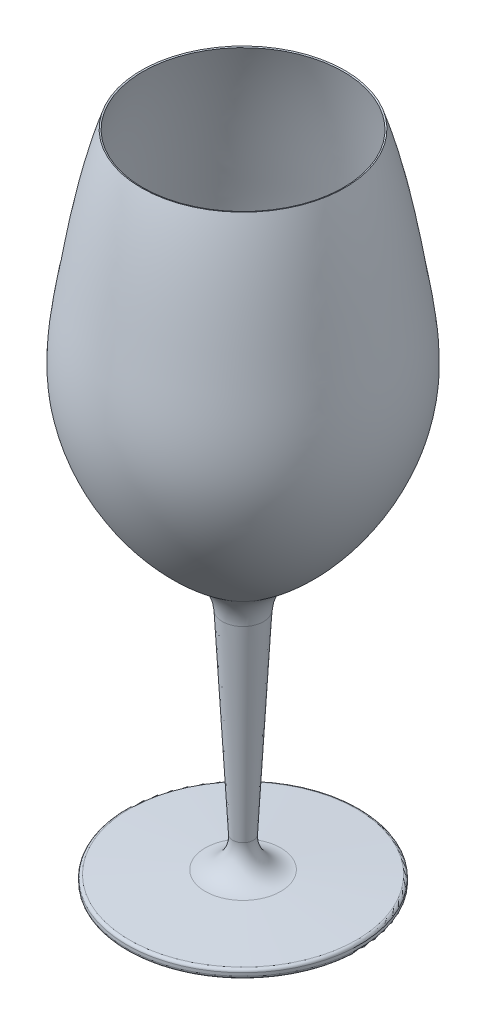
from build123d import *

# Parameters (mm, degrees)
REVOLVE_THIN1_OUTLINE_W   = 7.365807556
REVOLVE_THIN1_OUTLINE_H   = 0.5
REVOLVE_THIN1_OUTLINE_W_2 = 0.134192444
FILLET1_R                 = 10
FILLET2_R                 = 16
FILLET3_R                 = 1


# Read off the part's stored shape, not the designer's step: Revolve-Thin1
with BuildPart() as part:
    # Revolve-Thin1 outline → Revolve-Thin1 (revolve)
    with BuildSketch(Plane.XY):
        with Locations((3.682903778, 90.25)):
            Rectangle(REVOLVE_THIN1_OUTLINE_W, REVOLVE_THIN1_OUTLINE_H)
        with BuildLine():
            add(Edge.make_bspline(
                [(7.5, 90.577978433), (7.455285949, 90.551931479), (7.410555095, 90.525938631), (7.365807556, 90.5)],
                knots=[0.99893007, 0.99893007, 0.99893007, 0.99893007, 1, 1, 1, 1], degree=3))
            Line((7.365807556, 90.5), (7.5, 90.5))
            Line((7.5, 90.5), (7.5, 90.577978433))
        make_face()
        with Locations((7.432903778, 90.25)):
            Rectangle(REVOLVE_THIN1_OUTLINE_W_2, REVOLVE_THIN1_OUTLINE_H)
        with BuildLine():
            add(Edge.make_bspline(
                [(34.526035746, 116.224068176), (34.512660612, 116.204150697), (34.499276892, 116.184238728), (27.396765127, 105.626990517), (17.903178429, 96.638067113), (7.5, 90.577978433)],
                knots=[0.749529738, 0.749529738, 0.749529738, 0.749529738, 0.75, 0.75, 0.99893007, 0.99893007, 0.99893007, 0.99893007], degree=3))
            Line((7.5, 90.577978433), (7.5, 90.5))
            Line((7.5, 90.5), (8.352912818, 90.5))
            add(Edge.make_bspline(
                [(34.526035746, 115.332949182), (27.575400822, 105.173919249), (18.409466047, 96.486433496), (8.352912818, 90.5)],
                knots=[0.753639532, 0.753639532, 0.753639532, 0.753639532, 0.993242921, 0.993242921, 0.993242921, 0.993242921], degree=3))
            Line((34.526035746, 115.332949182), (34.526035746, 116.224068176))
        make_face()
        with BuildLine():
            Line((8.352912818, 90.5), (7.5, 90.5))
            Line((7.5, 90.5), (7.5, 90))
            add(Edge.make_bspline(
                [(8.352912818, 90.5), (8.069306953, 90.331175989), (7.784992776, 90.16450013), (7.5, 90)],
                knots=[0.993242921, 0.993242921, 0.993242921, 0.993242921, 1, 1, 1, 1], degree=3))
        make_face()
        with BuildLine():
            add(Edge.make_bspline(
                [(35, 116.937654659), (34.843239639, 116.699022317), (34.685245979, 116.461154885), (34.526035746, 116.224068176)],
                knots=[0.743931995, 0.743931995, 0.743931995, 0.743931995, 0.749529738, 0.749529738, 0.749529738, 0.749529738], degree=3))
            Line((34.526035746, 116.224068176), (34.526035746, 115.332949182))
            add(Edge.make_bspline(
                [(35, 116.033110225), (34.843184029, 115.798961501), (34.685190644, 115.565569566), (34.526035746, 115.332949182)],
                knots=[0.748153119, 0.748153119, 0.748153119, 0.748153119, 0.753639532, 0.753639532, 0.753639532, 0.753639532], degree=3))
            Line((35, 116.033110225), (35, 116.937654659))
        make_face()
        with BuildLine():
            add(Edge.make_bspline(
                [(35, 223.406176232), (38.707754789, 211.992882418), (41.019034398, 200.307274966), (43.602577081, 185.350494264), (44.119501526, 182.246673107), (45.155101131, 176.021305771), (45.666413266, 172.90348054), (46.954080187, 163.557105891), (47.483447687, 157.336251858), (46.887857201, 148.10906378), (46.448454036, 145.046089868), (45.124841561, 138.98077957), (44.242019923, 135.979713916), (41.104468819, 127.423109067), (38.330596439, 122.007737575), (35, 116.937654659)],
                knots=[0.010062995, 0.010062995, 0.010062995, 0.010062995, 0.25, 0.25, 0.3125, 0.3125, 0.375, 0.375, 0.5, 0.5, 0.5625, 0.5625, 0.625, 0.625, 0.743931995, 0.743931995, 0.743931995, 0.743931995], degree=3))
            Line((35, 116.937654659), (35, 116.033110225))
            add(Edge.make_bspline(
                [(47.720690898, 155.470930616), (47.720690908, 153.64342431), (47.202796274, 139.839119264), (41.88477425, 126.313065149), (35, 116.033110225)],
                knots=[0.470604098, 0.470604098, 0.470604098, 0.470604098, 0.507280243, 0.748153119, 0.748153119, 0.748153119, 0.748153119], degree=3))
            add(Edge.make_bspline(
                [(35.053402076, 224.840758405), (39.935404776, 210.255770266), (43.812104415, 187.210591853), (47.720690851, 163.624535934), (47.720690898, 155.470930616)],
                knots=[0.001113252, 0.001113252, 0.001113252, 0.001113252, 0.306969744, 0.470604098, 0.470604098, 0.470604098, 0.470604098], degree=3))
            Line((35.053402076, 224.840758405), (35, 224.840758405))
            Line((35, 224.840758405), (35, 223.406176232))
        make_face()
        with BuildLine():
            Line((35, 224.840758405), (34.526035746, 224.840758405))
            add(Edge.make_bspline(
                [(34.526035746, 224.840758405), (34.68653601, 224.363047867), (34.844496189, 223.884851546), (35, 223.406176232)],
                knots=[0, 0, 0, 0, 0.010062995, 0.010062995, 0.010062995, 0.010062995], degree=3))
            Line((35, 223.406176232), (35, 224.840758405))
        make_face()
        Polygon((35, 225), (34.526035746, 224.840758405), (35, 224.840758405), align=None)
        with BuildLine():
            add(Edge.make_bspline(
                [(35, 225), (35.017831987, 224.946925146), (35.035632641, 224.893844612), (35.053402076, 224.840758405)],
                knots=[0, 0, 0, 0, 0.001113252, 0.001113252, 0.001113252, 0.001113252], degree=3))
            Line((35, 225), (35, 224.840758405))
            Line((35, 224.840758405), (35.053402076, 224.840758405))
        make_face()
    revolve(axis=Axis((0, 0, 0), (0, 1, 0)))

    # Sketch2 → Revolve-Thin9 (revolve)
    with BuildSketch(Plane.XY, mode=Mode.PRIVATE) as revolve_thin9_sk:
        Polygon((7.5, 90), (3, 5), (40, 3), (40, 0), (0, 0), (0, 90), (0.5, 90), (0.5, 0.5), (39.5, 0.5), (39.5, 2.5262971), (2.474294969, 4.527686561), (7.000699223, 90.026433571), align=None)
    revolve(revolve_thin9_sk.sketch.rotate(Axis((0, 231.75, 0), (0, -1, 0)), 90), axis=Axis((0, 231.75, 0), (0, -1, 0)))

    # Fillet1
    fillet1_edges = [part.edges().sort_by_distance(p)[0] for p in [
        (0, 5, -3),
    ]]
    fillet(fillet1_edges, radius=FILLET1_R)

    # Fillet2
    fillet2_edges = [part.edges().sort_by_distance(p)[0] for p in [
        (-5.303300859, 90, -5.303300859),
    ]]
    fillet(fillet2_edges, radius=FILLET2_R)

    # Fillet3
    fillet3_edges = [part.edges().sort_by_distance(p)[0] for p in [
        (0, 3, -40),
        (0, 0, -40),
    ]]
    fillet(fillet3_edges, radius=FILLET3_R)


solid = part.part
